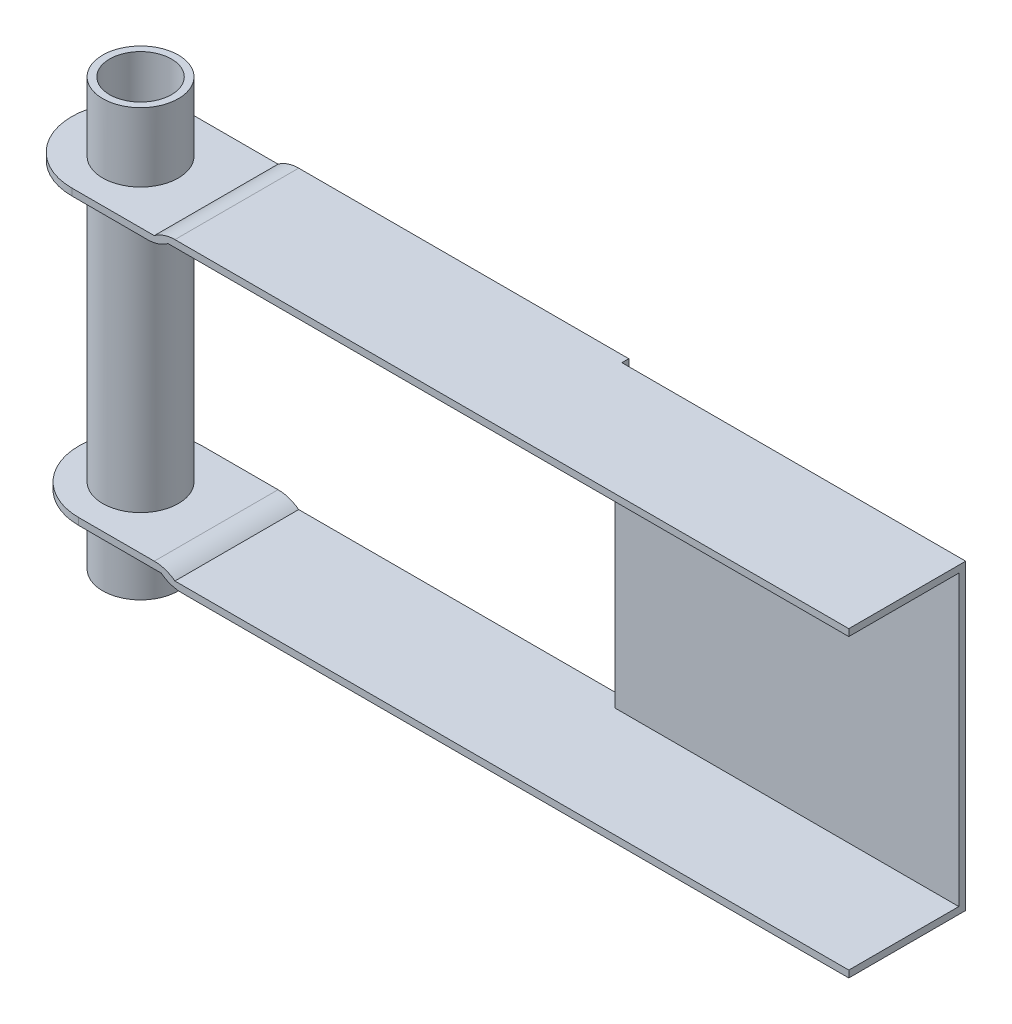
from build123d import *

# Parameters (mm, degrees)
CROQUIS1_W                    = 50
CROQUIS1_H                    = 44
SALIENTE_EXTRUIR1_DEPTH       = 1
CROQUIS2_W                    = 50
CROQUIS2_H                    = 1
SALIENTE_EXTRUIR2_DEPTH       = 16
CROQUIS3_W                    = 1
CROQUIS3_H                    = 1
SALIENTE_EXTRUIR3_DEPTH       = 50
CROQUIS4_W                    = 1
CROQUIS4_H                    = 18
SALIENTE_EXTRUIR4_DEPTH       = 1
CROQUIS6_W                    = 1
CROQUIS6_H                    = 18
SALIENTE_EXTRUIR5_DEPTH       = 1
CROQUIS12_W                   = 1
CROQUIS12_H                   = 18
SALIENTE_EXTRUIR11_DEPTH      = 1
CROQUIS13_W                   = 18
CROQUIS13_H                   = 1
SALIENTE_EXTRUIR12_DEPTH      = 21
CROQUIS14_W                   = 18
CROQUIS14_H                   = 1
SALIENTE_EXTRUIR13_DEPTH      = 21
REDONDEO4_R                   = 9
REDONDEO5_R                   = 9
CROQUIS15_W                   = 18
CROQUIS15_H                   = 1
SALIENTE_EXTRUIR14_DEPTH      = 1
CROQUIS16_W                   = 18
CROQUIS16_H                   = 1
SALIENTE_EXTRUIR15_DEPTH      = 1
REDONDEO6_R                   = 5
REDONDEO7_R                   = 5
SALIENTE_EXTRUIR22_DEPTH      = 10
SALIENTE_EXTRUIR22_DEPTH_BACK = 54
CROQUIS17_R                   = 5.5
CORTAR_EXTRUIR5_START         = -2
CROQUIS25_R                   = 5.5
CORTAR_EXTRUIR5_DEPTH         = 2
CROQUIS26_R                   = 4.5
CORTAR_EXTRUIR6_DEPTH         = 97.524608261


# Some blends are built 0.0001 mm under size
with BuildPart() as part:
    # Croquis1 → Saliente-Extruir1 (new body)
    with BuildSketch(Plane.XY):
        with Locations((25, -22)):
            Rectangle(CROQUIS1_W, CROQUIS1_H)
    extrude(amount=SALIENTE_EXTRUIR1_DEPTH)

    # Croquis2 → Saliente-Extruir2 (add)
    with BuildSketch(Plane.XY.offset(1)):
        with Locations((25, -0.5)):
            Rectangle(CROQUIS2_W, CROQUIS2_H)
        with Locations((25, -43.5)):
            Rectangle(CROQUIS2_W, CROQUIS2_H)
    extrude(amount=SALIENTE_EXTRUIR2_DEPTH)

    # Croquis3 → Saliente-Extruir3 (add)
    with BuildSketch(Plane.ZY):
        Polygon((0, -44), (17, -44), (17, -43), (1, -43), (0, -43), align=None)
        with Locations((-0.5, -43.5)):
            Rectangle(CROQUIS3_W, CROQUIS3_H)
        with Locations((-0.5, -0.5)):
            Rectangle(CROQUIS3_W, CROQUIS3_H)
        Polygon((0, 0), (0, -1), (1, -1), (17, -1), (17, 0), align=None)
    extrude(amount=SALIENTE_EXTRUIR3_DEPTH)



with BuildPart() as body_2:
    # Croquis4 → Saliente-Extruir4 (new body)
    with BuildSketch(Plane.XZ.offset(1)):
        with Locations((-50.5, 8)):
            Rectangle(CROQUIS4_W, CROQUIS4_H)
    extrude(amount=SALIENTE_EXTRUIR4_DEPTH)


with BuildPart() as part_1:
    add(part.part)

    add(body_2.part)  # Saliente-Extruir5 merges body 2
    # Croquis6 → Saliente-Extruir5 (add)
    with BuildSketch(Plane(origin=(0, -1, 0), x_dir=(1, 0, 0), z_dir=(0, 1, 0))):
        with Locations((-50.5, -8)):
            Rectangle(CROQUIS6_W, CROQUIS6_H)
    extrude(amount=SALIENTE_EXTRUIR5_DEPTH)

    # Croquis12 → Saliente-Extruir11 (add)
    with BuildSketch(Plane(origin=(0, -43, 0), x_dir=(1, 0, 0), z_dir=(0, 1, 0))):
        with Locations((-49.5, -8)):
            Rectangle(CROQUIS12_W, CROQUIS12_H)
    extrude(amount=SALIENTE_EXTRUIR11_DEPTH)

    # Croquis13 → Saliente-Extruir12 (add)
    with BuildSketch(Plane.ZY.offset(50)):
        with Locations((8, -42.5)):
            Rectangle(CROQUIS13_W, CROQUIS13_H)
    extrude(amount=SALIENTE_EXTRUIR12_DEPTH)

    # Croquis14 → Saliente-Extruir13 (add)
    with BuildSketch(Plane.ZY.offset(51)):
        with Locations((8, -1.5)):
            Rectangle(CROQUIS14_W, CROQUIS14_H)
    extrude(amount=SALIENTE_EXTRUIR13_DEPTH)

    # Redondeo4
    redondeo4_edges = [part_1.edges().sort_by_distance(p)[0] for p in [
        (-72, -1.5, -1),
        (-72, -1.5, 17),
    ]]
    fillet(redondeo4_edges, radius=REDONDEO4_R - 0.0001)  # a hair under: the kernel refuses the full size

    # Redondeo5
    redondeo5_edges = [part_1.edges().sort_by_distance(p)[0] for p in [
        (-71, -42.5, -1),
        (-71, -42.5, 17),
    ]]
    fillet(redondeo5_edges, radius=REDONDEO5_R - 0.0001)  # a hair under: the kernel refuses the full size

    # Croquis15 → Saliente-Extruir14 (add)
    with BuildSketch(Plane(origin=(-49, 0, 0), x_dir=(0, 0, -1), z_dir=(1, 0, 0))):
        with Locations((-8, -42.5)):
            Rectangle(CROQUIS15_W, CROQUIS15_H)
    extrude(amount=SALIENTE_EXTRUIR14_DEPTH)

    # Croquis16 → Saliente-Extruir15 (add)
    with BuildSketch(Plane(origin=(-50, 0, 0), x_dir=(0, 0, -1), z_dir=(1, 0, 0))):
        with Locations((-8, -1.5)):
            Rectangle(CROQUIS16_W, CROQUIS16_H)
    extrude(amount=SALIENTE_EXTRUIR15_DEPTH)

    # Redondeo6
    # the kernel refuses this fillet: 5 mm, written as the material it takes off along each edge
    with BuildSketch(Plane(origin=(-48, -42, -8.5), x_dir=(-1, 0, 0), z_dir=(0, 0, 1))) as redondeo6_piece_1:
        with BuildLine():
            CenterArc((3, 5), REDONDEO6_R, 233.130102354, 36.869897646)
            Line((0, 1), (-0.06, 0.92))
            ThreePointArc((-0.06, 0.92), (-0.1, 0.5), (-0.1, 0))
            Line((-0.1, 0), (0, -0.1))
            Line((0, -0.1), (3, -0.1))
            Line((3, -0.1), (3, 0))
        make_face()
    extrude(amount=33, mode=Mode.SUBTRACT)
    with BuildSketch(Plane(origin=(-49, -2, -8.5), x_dir=(0, 1, 0), z_dir=(0, 0, 1))) as redondeo6_piece_2:
        with BuildLine():
            CenterArc((5, 3), REDONDEO6_R, 180, 36.869897646)
            Line((0, 3), (-0.1, 3))
            Line((-0.1, 3), (-0.1, 0))
            Line((-0.1, 0), (0, -0.1))
            ThreePointArc((0, -0.1), (0.5, -0.1), (0.92, -0.06))
            Line((0.92, -0.06), (1, 0))
        make_face()
    extrude(amount=33, mode=Mode.SUBTRACT)

    # Redondeo7
    # the kernel refuses this fillet: 5 mm, written as the material it takes off along each edge
    with BuildSketch(Plane(origin=(-50, -44, 24.5), x_dir=(1, 0, 0), z_dir=(0, 0, -1)), Plane(origin=(-51, 0, -8.5), x_dir=(1, 0, 0), z_dir=(0, 0, 1))) as redondeo7_piece_1:
        with BuildLine():
            CenterArc((3, -5), REDONDEO7_R, 90, 36.869897646)
            Line((0, -1), (-0.06, -0.92))
            ThreePointArc((-0.06, -0.92), (-0.1, -0.5), (-0.1, 0))
            Line((-0.1, 0), (0, 0.1))
            Line((0, 0.1), (3, 0.1))
            Line((3, 0.1), (3, 0))
        make_face()
    extrude(amount=33, mode=Mode.SUBTRACT)

    # Croquis17 → Saliente-Extruir22 (add, two sides: drawn at the far end of the back side and taken through both)
    with BuildSketch(Plane.XZ.offset(43).offset(-SALIENTE_EXTRUIR22_DEPTH_BACK)):
        with Locations(Location((-62, 8, 0), (0, 0, 270))):
            Circle(CROQUIS17_R)
    extrude(amount=SALIENTE_EXTRUIR22_DEPTH + SALIENTE_EXTRUIR22_DEPTH_BACK)

    # Croquis25 → Cortar-Extruir5 (cut)
    with BuildSketch(Plane(origin=(0, 11, 0), x_dir=(1, 0, 0), z_dir=(0, 1, 0)).offset(CORTAR_EXTRUIR5_START)):
        with Locations(Location((-62, -8, 0), (0, 0, 90))):
            Circle(CROQUIS25_R)
    extrude(amount=CORTAR_EXTRUIR5_DEPTH, mode=Mode.SUBTRACT)

    # Croquis26 → Cortar-Extruir6 (cut, through all)
    with BuildSketch(Plane(origin=(0, 9, 0), x_dir=(1, 0, 0), z_dir=(0, 1, 0))):
        with Locations(Location((-62, -8, 0), (0, 0, 270))):
            Circle(CROQUIS26_R)
    extrude(amount=-CORTAR_EXTRUIR6_DEPTH, mode=Mode.SUBTRACT)


solid = part_1.part
